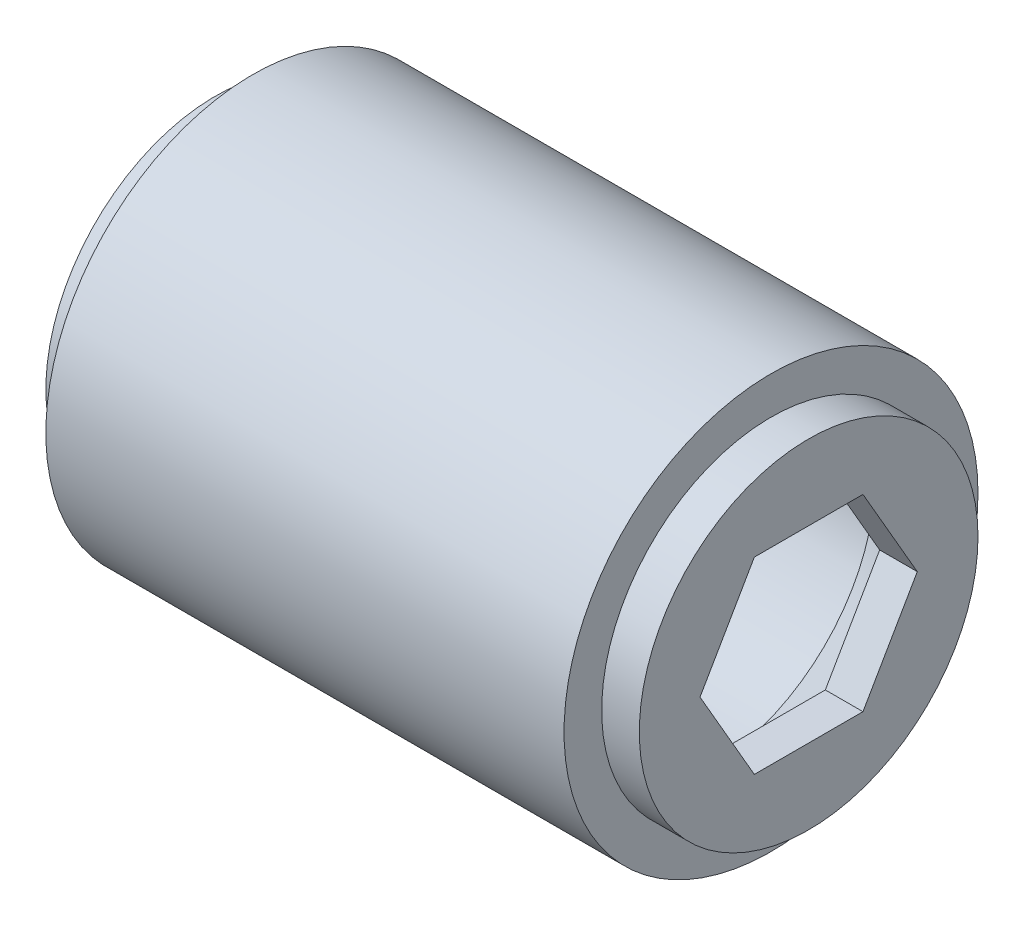
from build123d import *

# Parameters (mm, degrees)
CUT_EXTRUDE1_DEPTH = 36.167763648


with BuildPart() as part:
    # Sketch4 → Revolve2 (revolve)
    with BuildSketch(Plane.XY):
        Polygon((-29.54, 11), (-2, 11), (-2, 9), (0, 9), (0, 7), (0, 0), (-2, 0), (-2, 7), (-5.464101615, 9), (-26.075898385, 9), (-29.54, 7), (-29.54, 0), (-31.54, 0), (-31.54, 7), (-31.54, 9), (-29.54, 9), align=None)
    revolve(axis=Axis((0, 0, 0), (-1, 0, 0)))

    # Sketch5 → Cut-Extrude1 (cut, through all)
    with BuildSketch(Plane.ZY.offset(31.54)):
        Polygon((-2.886751346, 5), (-5.773502692, 0), (-2.886751346, -5), (2.886751346, -5), (5.773502692, 0), (2.886751346, 5), align=None)
    extrude(amount=-CUT_EXTRUDE1_DEPTH, mode=Mode.SUBTRACT)


solid = part.part
